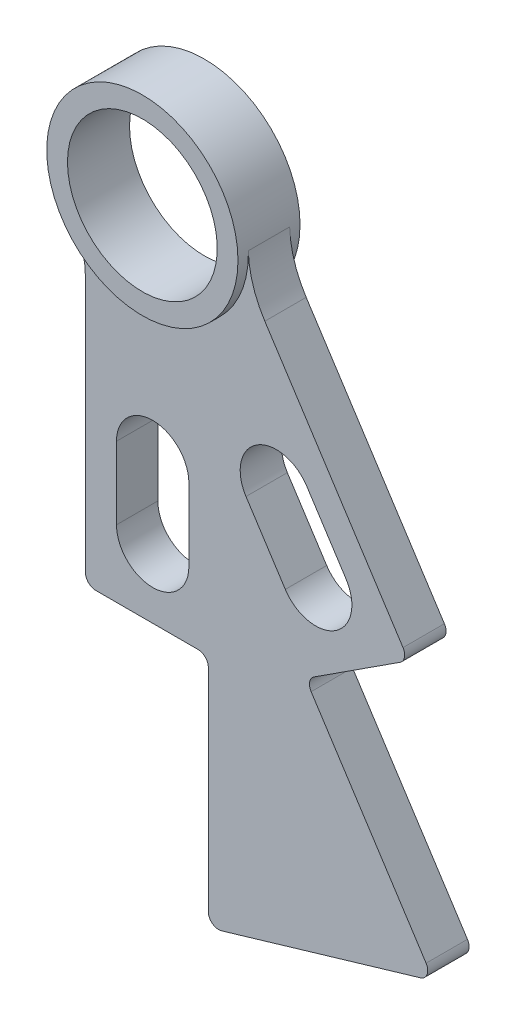
from build123d import *

# Parameters (mm, degrees)
SKETCH1_R           = 11.495405
BOSS_EXTRUDE2_DEPTH = 4.7625
BOSS_EXTRUDE3_DEPTH = 3.175
FILLET1_R           = 1.5875


with BuildPart() as part:
    # Sketch1 → Boss-Extrude2 (new, symmetric)
    with BuildSketch(Plane.XY):
        with BuildLine():
            ThreePointArc((14.672983865, 0.491098707), (-4.158599684, 14.079903484), (-12.585193267, -7.559797873))
            ThreePointArc((-12.585193267, -7.559797873), (4.158599684, -14.079903484), (14.672983865, 0.491098707))
        make_face()
        Circle(SKETCH1_R, mode=Mode.SUBTRACT)
    extrude(amount=BOSS_EXTRUDE2_DEPTH, both=True)

    # Sketch1<4> → Boss-Extrude3 (add, symmetric)
    with BuildSketch(Plane.XY):
        with BuildLine():
            ThreePointArc((-12.585193267, -7.559797873), (-10.89585042, -11.492870345), (-10.31875, -15.734319794))
            Line((-10.31875, -15.734319794), (-10.31875, -56.374319794))
            Line((-10.31875, -56.374319794), (8.54075, -56.374319794))
            Line((8.54075, -56.374319794), (8.54075, -92.573898471))
            Line((8.54075, -92.573898471), (43.12682453, -82.358655251))
            Line((43.12682453, -82.358655251), (23.458960581, -51.968120144))
            Line((23.458960581, -51.968120144), (39.292025986, -41.721424085))
            Line((39.292025986, -41.721424085), (17.211603503, -7.603033986))
            ThreePointArc((17.211603503, -7.603033986), (15.391641433, -3.728672569), (14.672983865, 0.491098707))
            ThreePointArc((14.672983865, 0.491098707), (4.158599684, -14.079903484), (-12.585193267, -7.559797873))
        make_face()
        with BuildLine():
            ThreePointArc((5.55625, -46.055569794), (0, -51.611819794), (-5.55625, -46.055569794))
            Line((-5.55625, -46.055569794), (-5.55625, -34.943069794))
            ThreePointArc((-5.55625, -34.943069794), (0, -29.386819794), (5.55625, -34.943069794))
            Line((5.55625, -34.943069794), (5.55625, -46.055569794))
        make_face(mode=Mode.SUBTRACT)
        with BuildLine():
            ThreePointArc((29.687419875, -35.646101109), (28.04160399, -43.329532516), (20.358172583, -41.683716631))
            Line((20.358172583, -41.683716631), (14.32055706, -32.354469339))
            ThreePointArc((14.32055706, -32.354469339), (15.966372945, -24.671037931), (23.649804353, -26.316853816))
            Line((23.649804353, -26.316853816), (29.687419875, -35.646101109))
        make_face(mode=Mode.SUBTRACT)
    extrude(amount=BOSS_EXTRUDE3_DEPTH, both=True)

    # Fillet1
    fillet1_edges = [part.edges().sort_by_distance(p)[0] for p in [
        (-10.31875, -56.374319794, 0),
        (39.292025986, -41.721424085, 0),
        (8.54075, -92.573898471, 0),
        (43.12682453, -82.358655251, 0),
        (23.458960581, -51.968120144, 0),
        (8.54075, -56.374319794, 0),
    ]]
    fillet(fillet1_edges, radius=FILLET1_R)


solid = part.part
